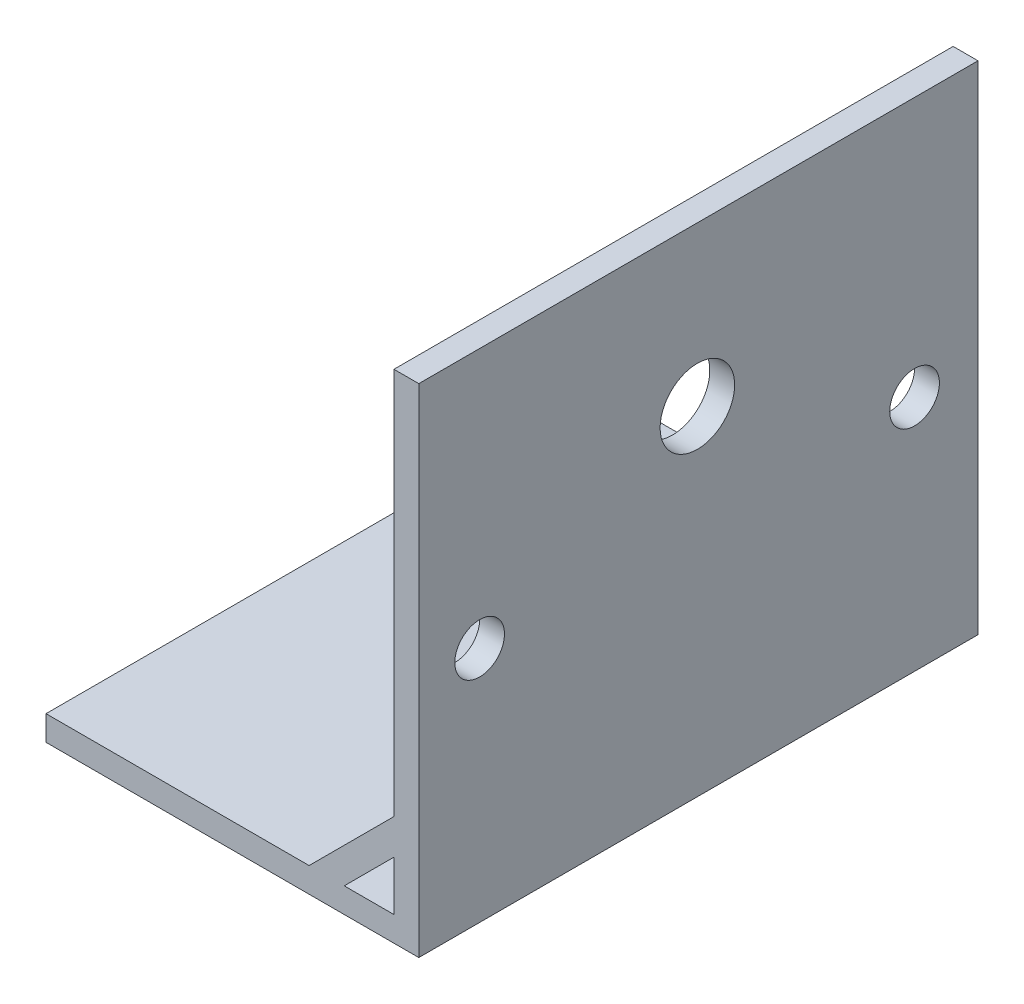
from build123d import *

# Parameters (mm, degrees)
SKETCH1_W           = 28
SKETCH1_H           = 45
BOSS_EXTRUDE1_DEPTH = 2
SKETCH1_3_W         = 2
SKETCH1_3_H         = 45
BOSS_EXTRUDE2_DEPTH = 40
BOSS_EXTRUDE3_DEPTH = 2
SKETCH4_R           = 2
SKETCH4_R_2         = 3
CUT_EXTRUDE1_DEPTH  = 54.761045377


with BuildPart() as part:
    # Sketch1 → Boss-Extrude1 (new body)
    with BuildSketch(Plane(origin=(0, 0, 0), x_dir=(1, 0, 0), z_dir=(0, 1, 0))):
        with Locations((-1, 0)):
            Rectangle(SKETCH1_W, SKETCH1_H)
    extrude(amount=BOSS_EXTRUDE1_DEPTH)

    # Sketch1<3> → Boss-Extrude2 (add)
    with BuildSketch(Plane(origin=(0, 0, 0), x_dir=(1, 0, 0), z_dir=(0, 1, 0))):
        with Locations((14, 0)):
            Rectangle(SKETCH1_3_W, SKETCH1_3_H)
    extrude(amount=BOSS_EXTRUDE2_DEPTH)

    # Sketch2 → Boss-Extrude3 (add)
    with BuildSketch(Plane.XY.offset(22.5)):
        Polygon((9, 2), (13, 6), (13, 8.828427125), (6.171572875, 2), align=None)
    boss_extrude3 = extrude(amount=-BOSS_EXTRUDE3_DEPTH)

    # Mirror1: Boss-Extrude3 across plane
    add(boss_extrude3.mirror(Plane.XY))

    # Sketch4 → Cut-Extrude1 (cut, through all)
    with BuildSketch(Plane.ZY.offset(-13)):
        with Locations((-17.395831298, 19.106582612)):
            Circle(SKETCH4_R)
        with Locations((17.604168702, 19.106582612)):
            Circle(SKETCH4_R)
        with Locations((0.082508189, 27.209126049)):
            Circle(SKETCH4_R_2)
    extrude(amount=-CUT_EXTRUDE1_DEPTH, mode=Mode.SUBTRACT)


solid = part.part
